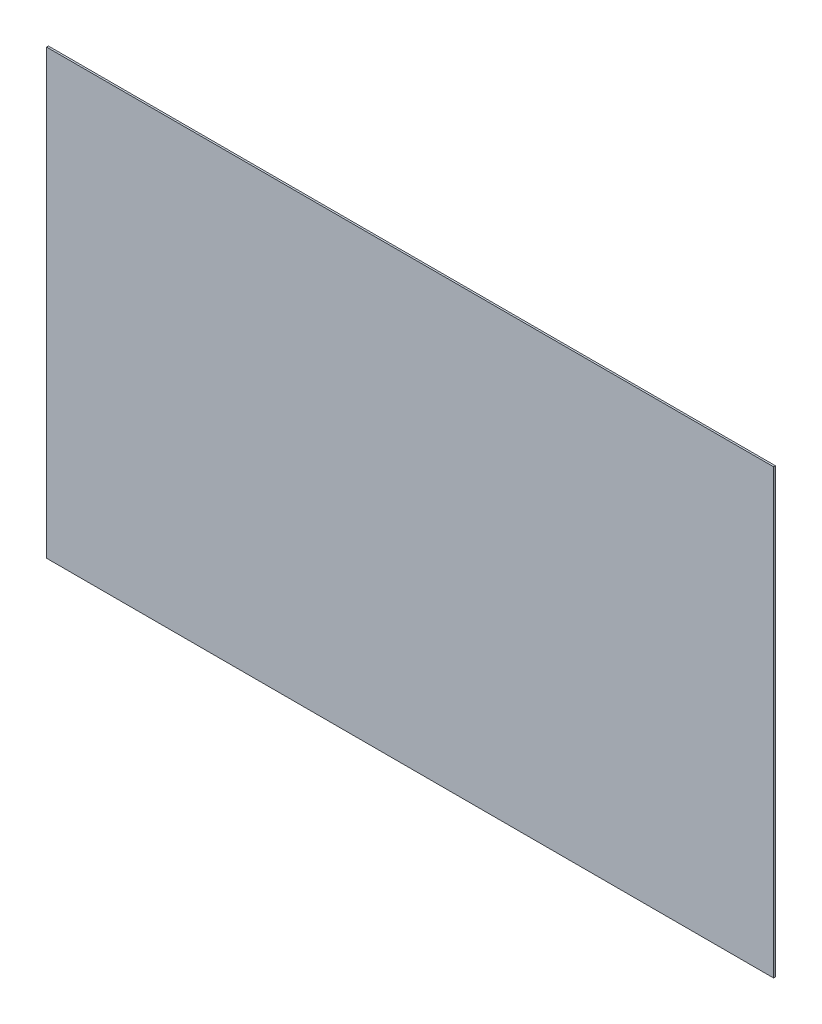
from build123d import *

# Parameters (mm, degrees)
SKETCH1_W           = 625.602
SKETCH1_H           = 381
BOSS_EXTRUDE1_DEPTH = 1.5875


with BuildPart() as part:
    # Sketch1 → Boss-Extrude1 (new body)
    with BuildSketch(Plane.XY):
        with Locations((312.801, 190.5)):
            Rectangle(SKETCH1_W, SKETCH1_H)
    extrude(amount=BOSS_EXTRUDE1_DEPTH)


solid = part.part
